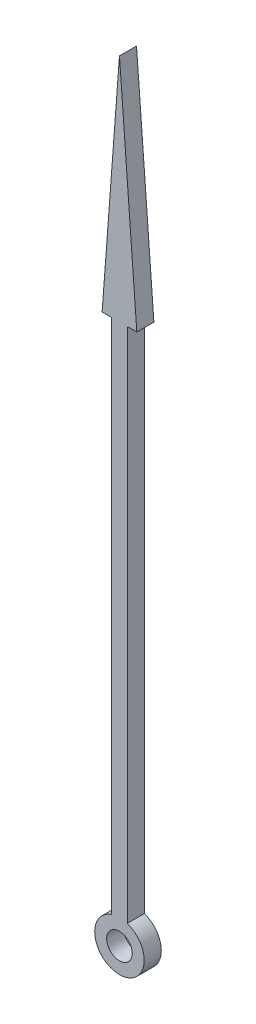
from build123d import *

# Parameters (mm, degrees)
SKETCH_2_R          = 0.29
SKETCH_2_R_2        = 0.15
EXTRUDE_1_DEPTH     = 0.2
EXTRUDE_3_DEPTH     = 0.2
CUT_EXTRUDE_START   = -0.2
CUT_EXTRUDE_2_DEPTH = 0.2


# Read off the part's stored shape, not the designer's step: 切除-拉伸2
with BuildPart() as part:
    # 草图2 → 凸台-拉伸1 (new body)
    with BuildSketch(Plane.XY):
        Circle(SKETCH_2_R)
        Circle(SKETCH_2_R_2, mode=Mode.SUBTRACT)
    extrude(amount=EXTRUDE_1_DEPTH)

    # 草图3 → 凸台-拉伸3 (add)
    with BuildSketch(Plane.XY.offset(0.2)):
        Polygon((0, 0), (0, 9.030931314), (-0.203353638, 6.330931314), (-0.091221417, 6.330931314), (-0.091221417, 0), align=None)
    extrude_3 = extrude(amount=-EXTRUDE_3_DEPTH)

    # 镜向1: 凸台-拉伸3 across plane
    add(extrude_3.mirror(Plane(origin=(0, 0, 0), x_dir=(0, 0, 1), z_dir=(1, 0, 0))))

    # 切除-拉伸2 outline → 切除-拉伸2 (cut)
    with BuildSketch(Plane.XY.offset(0.2).offset(CUT_EXTRUDE_START)):
        with BuildLine():
            Line((0.091221417, 0), (0.091221417, 0.11907415))
            ThreePointArc((0.091221417, 0.11907415), (0, 0.15), (-0.091221417, 0.11907415))
            Line((-0.091221417, 0.11907415), (-0.091221417, 0))
            Line((-0.091221417, 0), (0.091221417, 0))
        make_face()
    extrude(amount=CUT_EXTRUDE_2_DEPTH, mode=Mode.SUBTRACT)


solid = part.part
